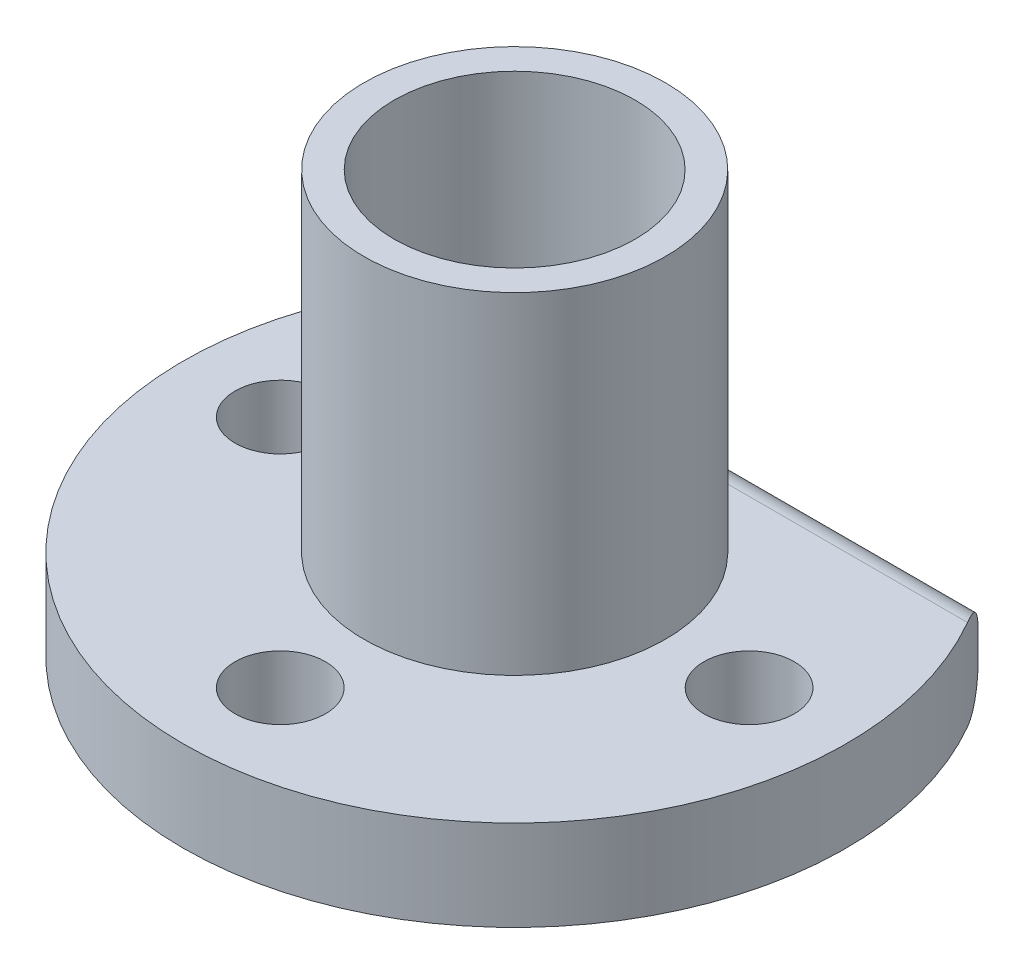
from build123d import *

# Parameters (mm, degrees)
ESQUISSE2_R             = 1.5
ENL_V_MAT_EXTRU_1_DEPTH = 21.928449536
ESQUISSE3_W             = 17.74823935
ESQUISSE3_H             = 7.774498086
ENL_V_MAT_EXTRU_2_DEPTH = 20.052558883
CONG_1_R                = 1


with BuildPart() as part:
    # Esquisse1 → Révolution1 (revolve)
    with BuildSketch(Plane.XY):
        Polygon((4, 0), (4, 15), (5, 15), (5, 4), (11, 4), (11, 1), (5, 1), (5, 0), align=None)
    revolve(axis=Axis((0, 0, 0), (0, 1, 0)))

    # Esquisse2 → Enlèv. mat.-Extru.1 (cut, through all)
    with BuildSketch(Plane.XZ.offset(-1)):
        with Locations((7.778174593, 0)):
            Circle(ESQUISSE2_R)
        with Locations((0, -7.778174593)):
            Circle(ESQUISSE2_R)
        with Locations((-7.778174593, 0)):
            Circle(ESQUISSE2_R)
        with Locations((0, 7.778174593)):
            Circle(ESQUISSE2_R)
    extrude(amount=-ENL_V_MAT_EXTRU_1_DEPTH, mode=Mode.SUBTRACT)

    # Esquisse3 → Enlèv. mat.-Extru.2 (cut, through all)
    with BuildSketch(Plane(origin=(0, 4, 0), x_dir=(1, 0, 0), z_dir=(0, 1, 0))):
        with Locations((0, 10.387249043)):
            Rectangle(ESQUISSE3_W, ESQUISSE3_H)
    extrude(amount=-ENL_V_MAT_EXTRU_2_DEPTH, mode=Mode.SUBTRACT)

    # Congé1
    cong_1_edges = [part.edges().sort_by_distance(p)[0] for p in [
        (-4.829574076, 1, -6.5),
        (-4.829574076, 4, -6.5),
    ]]
    fillet(cong_1_edges, radius=CONG_1_R)


solid = part.part
